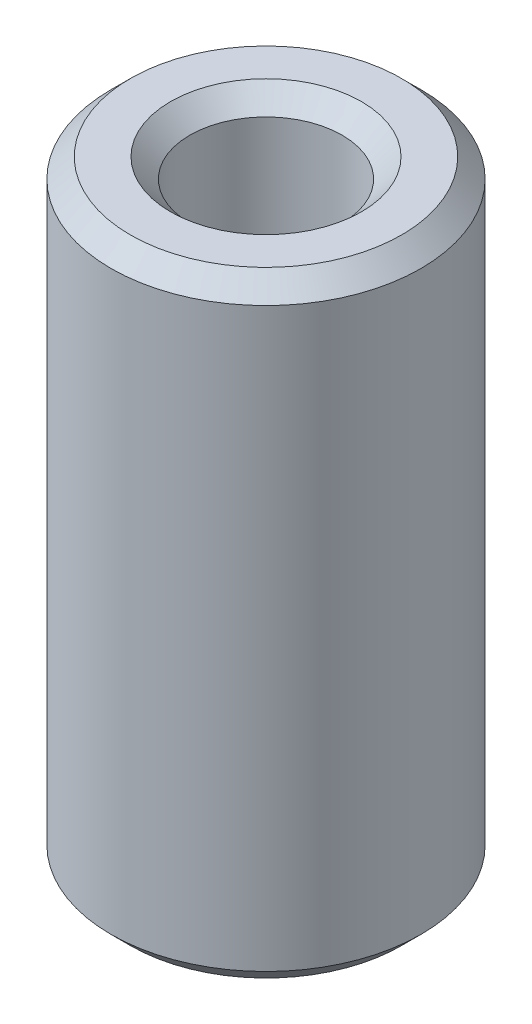
from build123d import *

# Parameters (mm, degrees)
SKETCH1_R           = 7.5
BOSS_EXTRUDE1_DEPTH = 29.788449063
SKETCH2_R           = 3.684354477
CUT_EXTRUDE1_DEPTH  = 32.620431647
CHAMFER1_SIZE       = 0.93742991


with BuildPart() as part:
    # Sketch1 → Boss-Extrude1 (new body)
    with BuildSketch(Plane(origin=(0, 0, 0), x_dir=(1, 0, 0), z_dir=(0, 1, 0))):
        Circle(SKETCH1_R)
    extrude(amount=BOSS_EXTRUDE1_DEPTH)

    # Sketch2 → Cut-Extrude1 (cut, through all)
    with BuildSketch(Plane(origin=(0, 0, 0), x_dir=(1, 0, 0), z_dir=(0, 1, 0))):
        Circle(SKETCH2_R)
    extrude(amount=CUT_EXTRUDE1_DEPTH, mode=Mode.SUBTRACT)

    # Chamfer1
    chamfer1_edges = [part.edges().sort_by_distance(p)[0] for p in [
        (-3.684354477, 29.788449063, 0),
        (-3.684354477, 0, 0),
        (-7.5, 0, 0),
        (-7.5, 29.788449063, 0),
    ]]
    chamfer(chamfer1_edges, length=CHAMFER1_SIZE)


solid = part.part
